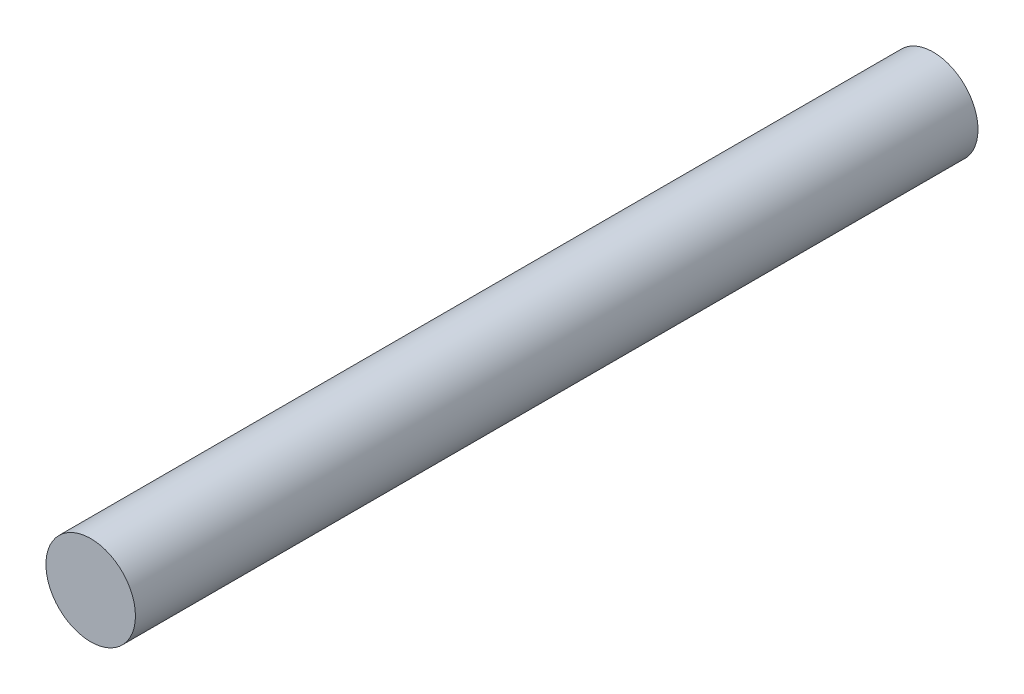
from build123d import *

# Parameters (mm, degrees)
CROQUIS1_R              = 10.795
SALIENTE_EXTRUIR1_DEPTH = 203.2


with BuildPart() as part:
    # Croquis1 → Saliente-Extruir1 (new body)
    with BuildSketch(Plane.XY):
        Circle(CROQUIS1_R)
    extrude(amount=SALIENTE_EXTRUIR1_DEPTH)


solid = part.part
